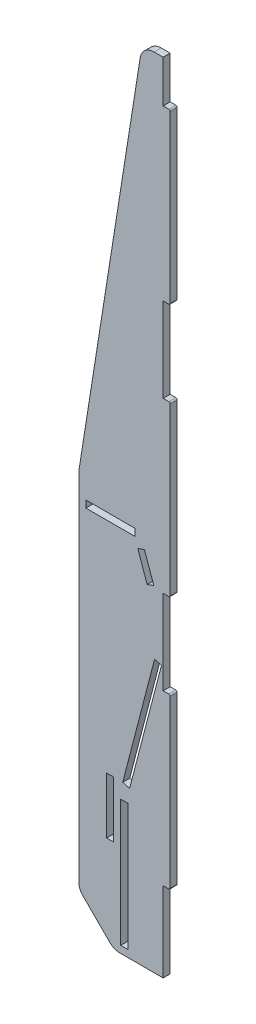
from build123d import *

# Parameters (mm, degrees)
BOSS_EXTRUDE1_DEPTH = 5
SKETCH2_W           = 5
SKETCH2_H           = 90
SKETCH2_H_2         = 40
SKETCH2_W_2         = 35
SKETCH2_H_3         = 5
CUT_EXTRUDE1_DEPTH  = 10
CUT_EXTRUDE2_DEPTH  = 10
FILLET1_R           = 1
FILLET2_R           = 10


with BuildPart() as part:
    # Sketch1 → Boss-Extrude1 (new body)
    with BuildSketch(Plane.XY):
        Polygon((80, 33.22), (20, 33.22), (20, 600), (80, 600), (80, 570), (85, 570), (85, 450), (80, 450), (80, 390), (85, 390), (85, 270), (80, 270), (80, 210), (85, 210), (85, 90), (80, 90), align=None)
    extrude(amount=BOSS_EXTRUDE1_DEPTH)

    # Sketch2 → Cut-Extrude1 (cut)
    with BuildSketch(Plane.XY.offset(5)):
        Polygon((66.666666667, 290.285954792), (61.952621459, 288.619288125), (68.619288125, 269.763107294), (73.333333333, 271.42977396), align=None)
        Polygon((73.902811841, 226.418897298), (51.258042728, 139.314279557), (56.146770345, 138.043346844), (78.791539458, 225.147964586), align=None)
        with Locations((52.33914543, 83.217091399)):
            Rectangle(SKETCH2_W, SKETCH2_H)
        with Locations((42.33914543, 119.314279557)):
            Rectangle(SKETCH2_W, SKETCH2_H_2)
        with Locations((42.5, 297.5)):
            Rectangle(SKETCH2_W_2, SKETCH2_H_3)
    extrude(amount=-CUT_EXTRUDE1_DEPTH, mode=Mode.SUBTRACT)

    # Sketch3 → Cut-Extrude2 (cut)
    with BuildSketch(Plane.XY.offset(5)):
        Polygon((20, 315), (65, 600), (1.513631165, 616.08755832), align=None)
        Polygon((45, 33.22), (20, 58.22), (13.452472792, 20.556075169), align=None)
    extrude(amount=-CUT_EXTRUDE2_DEPTH, mode=Mode.SUBTRACT)

    # Fillet1
    fillet1_edges = [part.edges().sort_by_distance(p)[0] for p in [
        (85, 570, 2.5),
        (85, 450, 2.5),
        (85, 390, 2.5),
        (85, 270, 2.5),
        (85, 210, 2.5),
        (85, 90, 2.5),
    ]]
    fillet(fillet1_edges, radius=FILLET1_R)

    # Fillet2
    fillet2_edges = [part.edges().sort_by_distance(p)[0] for p in [
        (65, 600, 2.5),
        (20, 315, 2.5),
        (20, 58.22, 2.5),
        (45, 33.22, 2.5),
    ]]
    fillet(fillet2_edges, radius=FILLET2_R)


solid = part.part
